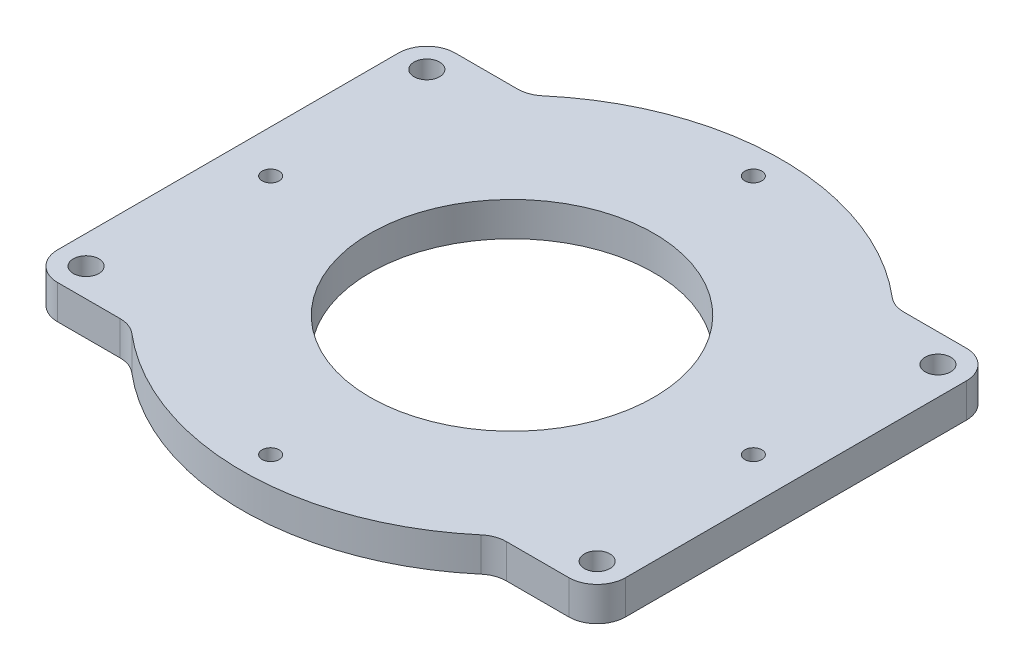
from build123d import *

# Parameters (mm, degrees)
SKETCH1_R           = 2.25
SKETCH1_R_2         = 25
SKETCH1_R_3         = 1.5
BOSS_EXTRUDE1_DEPTH = 6


with BuildPart() as part:
    # Sketch1 → Boss-Extrude1 (new body)
    with BuildSketch(Plane(origin=(0, 0, 0), x_dir=(1, 0, 0), z_dir=(0, 1, 0))):
        with BuildLine():
            Line((50, -30), (50, 30))
            ThreePointArc((50, 30), (48.535533906, 33.535533906), (45, 35))
            Line((45, 35), (34.003676272, 35))
            ThreePointArc((34.003676272, 35), (32.278512373, 35.307046823), (30.765230913, 36.19047619))
            ThreePointArc((30.765230913, 36.19047619), (0, 47.5), (-30.765230913, 36.19047619))
            ThreePointArc((-30.765230913, 36.19047619), (-32.278512373, 35.307046823), (-34.003676272, 35))
            Line((-34.003676272, 35), (-45, 35))
            ThreePointArc((-45, 35), (-48.535533906, 33.535533906), (-50, 30))
            Line((-50, 30), (-50, -30))
            ThreePointArc((-50, -30), (-48.535533906, -33.535533906), (-45, -35))
            Line((-45, -35), (-34.003676272, -35))
            ThreePointArc((-34.003676272, -35), (-32.278512373, -35.307046823), (-30.765230913, -36.19047619))
            ThreePointArc((-30.765230913, -36.19047619), (0, -47.5), (30.765230913, -36.19047619))
            ThreePointArc((30.765230913, -36.19047619), (32.278512373, -35.307046823), (34.003676272, -35))
            Line((34.003676272, -35), (45, -35))
            ThreePointArc((45, -35), (48.535533906, -33.535533906), (50, -30))
        make_face()
        with Locations((-45, 30)):
            Circle(SKETCH1_R, mode=Mode.SUBTRACT)
        with Locations((-45, -30)):
            Circle(SKETCH1_R, mode=Mode.SUBTRACT)
        with Locations((45, -30)):
            Circle(SKETCH1_R, mode=Mode.SUBTRACT)
        with Locations((45, 30)):
            Circle(SKETCH1_R, mode=Mode.SUBTRACT)
        Circle(SKETCH1_R_2, mode=Mode.SUBTRACT)
        with Locations((0, 42.5)):
            Circle(SKETCH1_R_3, mode=Mode.SUBTRACT)
        with Locations((42.5, 0)):
            Circle(SKETCH1_R_3, mode=Mode.SUBTRACT)
        with Locations((0, -42.5)):
            Circle(SKETCH1_R_3, mode=Mode.SUBTRACT)
        with Locations((-42.5, 0)):
            Circle(SKETCH1_R_3, mode=Mode.SUBTRACT)
    extrude(amount=BOSS_EXTRUDE1_DEPTH)


solid = part.part
